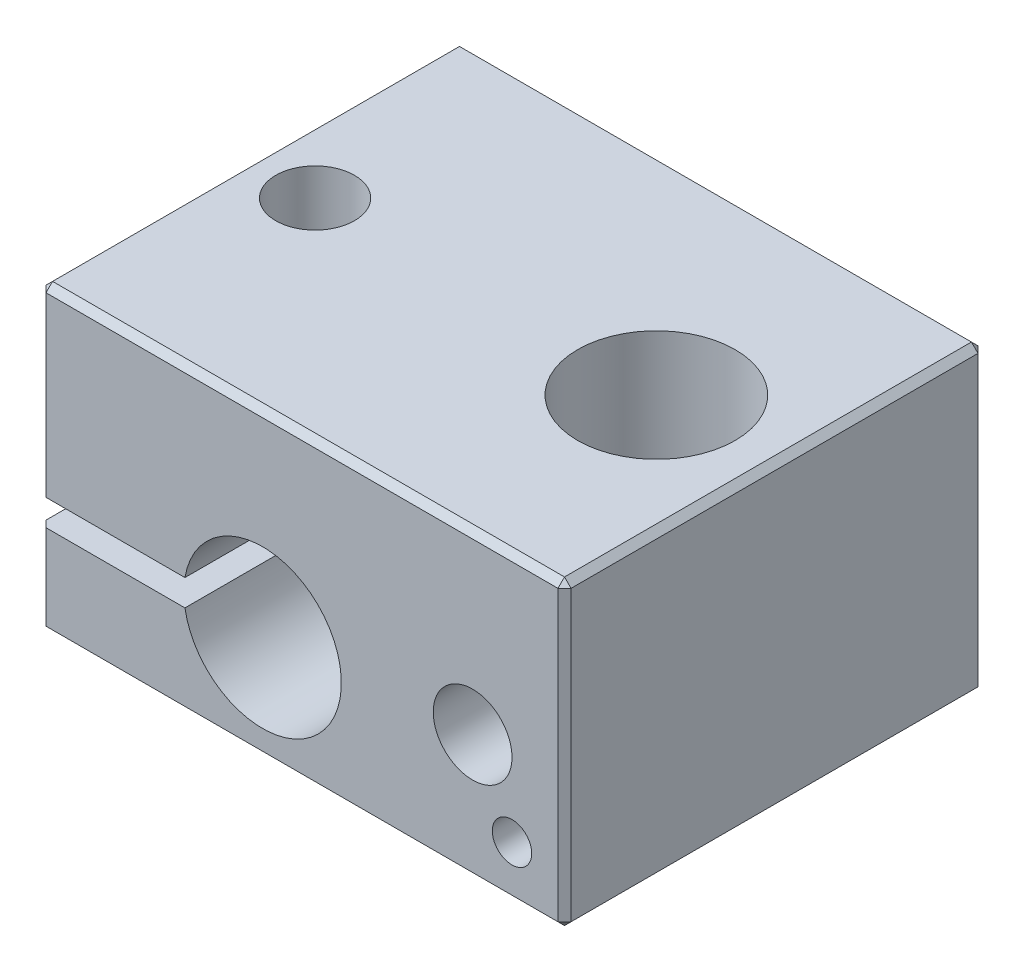
from build123d import *

# Parameters (mm, degrees)
SKETCH1_W                      = 20
SKETCH1_H                      = 16
BOSS_EXTRUDE1_DEPTH            = 11.5
CUT_EXTRUDE1_DEPTH             = 23.096379794
SKETCH3_W                      = 3
SKETCH3_H                      = 16
SKETCH4_W                      = 1.5
SKETCH4_H                      = 7
F_6_0_6_DIAMETER_HOLE1_D       = 6
F_3_0_3_DIAMETER_HOLE2_D       = 3
F_3_0_3_DIAMETER_HOLE3_D       = 3
F_3_0_3_DIAMETER_HOLE3_DEPTH   = 3.5
F_1_5_1_5_DIAMETER_HOLE1_D     = 1.5
F_1_5_1_5_DIAMETER_HOLE1_DEPTH = 4.5
CHAMFER1_SIZE                  = 0.25


with BuildPart() as part:
    # Sketch1 → Boss-Extrude1 (new body)
    with BuildSketch(Plane.XZ):
        Rectangle(SKETCH1_W, SKETCH1_H)
    extrude(amount=-BOSS_EXTRUDE1_DEPTH)

    # Sketch2 → Cut-Extrude1 (cut, through all)
    with BuildSketch(Plane(origin=(0, 0, -8), x_dir=(-1, 0, 0), z_dir=(0, 0, -1))):
        with BuildLine():
            Line((10, 3.5), (10, 4.5))
            Line((10, 4.5), (4.458039892, 4.5))
            ThreePointArc((4.458039892, 4.5), (4.5, 4), (4.458039892, 3.5))
            Line((4.458039892, 3.5), (10, 3.5))
        make_face()
    extrude(amount=-CUT_EXTRUDE1_DEPTH, mode=Mode.SUBTRACT)

    # Sketch3 → Cut-Revolve1 (revolve, cut)
    with BuildSketch(Plane(origin=(0, 4, 0), x_dir=(1, 0, 0), z_dir=(0, 1, 0))):
        Rectangle(SKETCH3_W, SKETCH3_H)
    revolve(axis=Axis((-1.5, 4, -8), (0, 0, 1)), mode=Mode.SUBTRACT)

    # Sketch4 → Ø3.0 (3) Diameter Hole1 (revolve, cut)
    with BuildSketch(Plane(origin=(-7.5, 4.5, 0), x_dir=(0, 0, -1), z_dir=(1, 0, 0))):
        with Locations((0.75, 3.5)):
            Rectangle(SKETCH4_W, SKETCH4_H)
    revolve(axis=Axis((-7.5, -1.85, 0), (0, 1, 0)), mode=Mode.SUBTRACT)

    # Ø6.0 (6) Diameter Hole1 (through all)
    with Locations(Plane(origin=(0, 0, 0), x_dir=(-1, 0, 0), z_dir=(0, -1, 0))):
        with Locations((-5.5, 0)):
            Hole(F_6_0_6_DIAMETER_HOLE1_D / 2)

    # Ø3.0 (3) Diameter Hole2 (through all)
    with Locations(Plane(origin=(0, 3.5, 0), x_dir=(1, 0, 0), z_dir=(0, 1, 0))):
        with Locations((-7.5, 0)):
            Hole(F_3_0_3_DIAMETER_HOLE2_D / 2)

    # Ø3.0 (3) Diameter Hole3
    with Locations(Plane.XY.offset(8)):
        with Locations((6.5, 4.8)):
            Hole(F_3_0_3_DIAMETER_HOLE3_D / 2, depth=F_3_0_3_DIAMETER_HOLE3_DEPTH)

    # Ø1.5 (1.5) Diameter Hole1
    with Locations(Plane.XY.offset(8)):
        with Locations((8, 2)):
            Hole(F_1_5_1_5_DIAMETER_HOLE1_D / 2, depth=F_1_5_1_5_DIAMETER_HOLE1_DEPTH)

    # Chamfer1
    chamfer1_edges = [part.edges().sort_by_distance(p)[0] for p in [
        (-10, 1.75, -8),
        (-10, 0, 0),
        (-10, 1.75, 8),
        (0, 0, -8),
        (0, 0, 8),
        (10, 0, 0),
        (-10, 8, -8),
        (-10, 11.5, 0),
        (-10, 8, 8),
        (10, 5.75, -8),
        (10, 5.75, 8),
        (0, 11.5, -8),
        (0, 11.5, 8),
        (10, 11.5, 0),
    ]]
    chamfer(chamfer1_edges, length=CHAMFER1_SIZE)


solid = part.part
